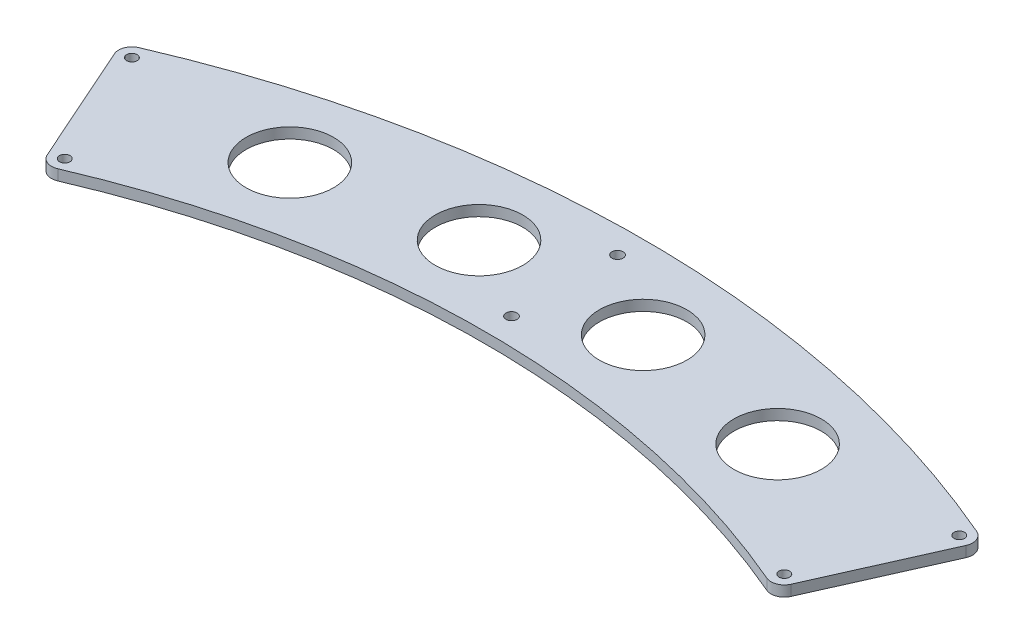
from build123d import *

# Parameters (mm, degrees)
SKETCH_1_R             = 16.5
SKETCH_1_R_2           = 2.1
SM_BASE_FLANGE_1_DEPTH = 4
FILLET_1_R             = 5
SKETCH_2_R             = 2
CUT_EXTRUDE_1_DEPTH    = 10


# Sheet-metal steps are written as plain solids
with BuildPart() as part:
    # Sketch 1 → Базовая кромка1 (new body)
    with BuildSketch(Plane(origin=(0, 0, 0), x_dir=(1, 0, 0), z_dir=(0, 1, 0))):
        with BuildLine():
            Line((-162.69465723, 365.418183057), (-138.290458646, 310.605455598))
            ThreePointArc((-138.290458646, 310.605455598), (0, 340), (138.290458646, 310.605455598))
            Line((138.290458646, 310.605455598), (162.69465723, 365.418183057))
            ThreePointArc((162.69465723, 365.418183057), (0, 400), (-162.69465723, 365.418183057))
        make_face()
        with Locations(Location((30.960802033, 368.702357922, 0), (0, 0, 270))):
            Circle(SKETCH_1_R, mode=Mode.SUBTRACT)
        with Locations(Location((-30.960802033, 368.702357922, 0), (0, 0, 270))):
            Circle(SKETCH_1_R, mode=Mode.SUBTRACT)
        with Locations(Location((92.015258251, 358.375769618, 0), (0, 0, 270))):
            Circle(SKETCH_1_R, mode=Mode.SUBTRACT)
        with Locations(Location((-92.015258251, 358.375769618, 0), (0, 0, 270))):
            Circle(SKETCH_1_R, mode=Mode.SUBTRACT)
        with Locations(Location((0, 350, 0), (0, 0, 270))):
            Circle(SKETCH_1_R_2, mode=Mode.SUBTRACT)
        with Locations(Location((0, 390, 0), (0, 0, 270))):
            Circle(SKETCH_1_R_2, mode=Mode.SUBTRACT)
    extrude(amount=-SM_BASE_FLANGE_1_DEPTH)

    # Скругление1
    fillet_1_edges = [part.edges().sort_by_distance(p)[0] for p in [
        (-138.290458646, -2, -310.605455598),
        (-162.69465723, -2, -365.418183057),
        (162.69465723, -2, -365.418183057),
        (138.290458646, -2, -310.605455598),
    ]]
    fillet(fillet_1_edges, radius=FILLET_1_R)

    # Эскиз2 → Вырез-Вытянуть1 (cut)
    with BuildSketch(Plane(origin=(0, 0, 0), x_dir=(1, 0, 0), z_dir=(0, 1, 0))):
        with Locations(Location((156.080374798, 362.85522816, 0), (0, 0, 270))):
            Circle(SKETCH_2_R)
        with Locations(Location((135.741676964, 317.173764891, 0), (0, 0, 270))):
            Circle(SKETCH_2_R)
        with Locations(Location((-135.741676964, 317.173764891, 0), (0, 0, 270))):
            Circle(SKETCH_2_R)
        with Locations(Location((-156.080374798, 362.85522816, 0), (0, 0, 270))):
            Circle(SKETCH_2_R)
    extrude(amount=-CUT_EXTRUDE_1_DEPTH, mode=Mode.SUBTRACT)


solid = part.part
